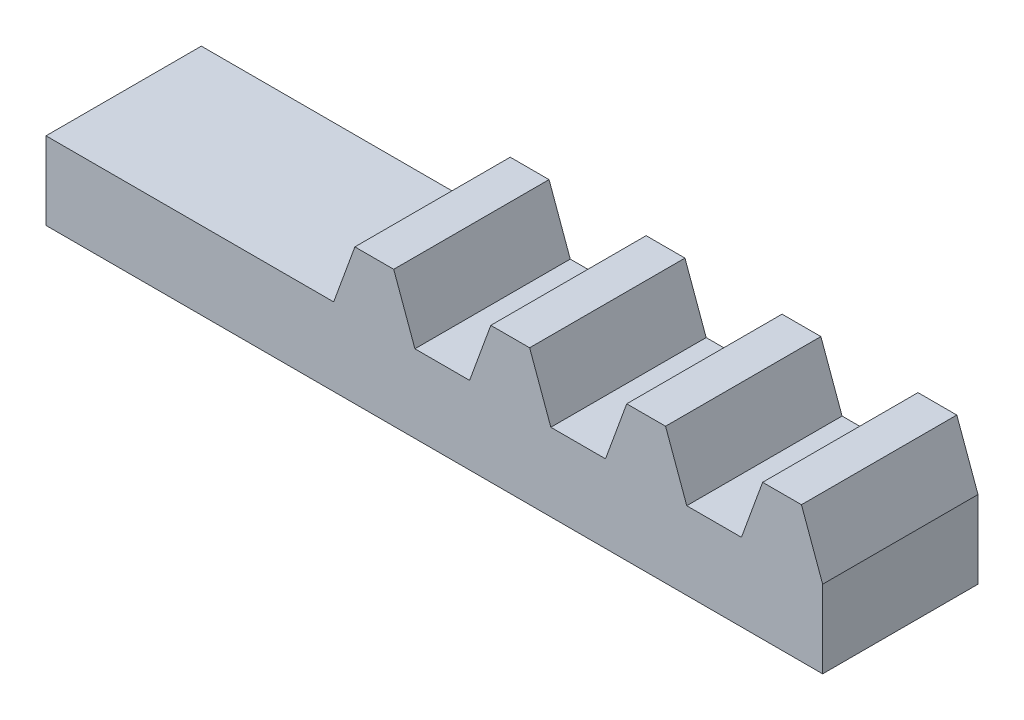
from build123d import *

# Parameters (mm, degrees)
BOSS_EXTRUDE1_DEPTH = 4


with BuildPart() as part:
    # Sketch1 → Boss-Extrude1 (new body)
    with BuildSketch(Plane.XY):
        Polygon((10, -1), (10, 1), (9.454044649, 2.5), (8.454044649, 2.5), (7.908089297, 1), (6.5, 1), (5.954044649, 2.5), (4.954044649, 2.5), (4.408089297, 1), (3, 1), (2.454044649, 2.5), (1.454044649, 2.5), (0.908089297, 1), (-0.5, 1), (-1.045955351, 2.5), (-2.045955351, 2.5), (-2.591910703, 1), (-10, 1), (-10, -1), align=None)
    extrude(amount=BOSS_EXTRUDE1_DEPTH)


solid = part.part
